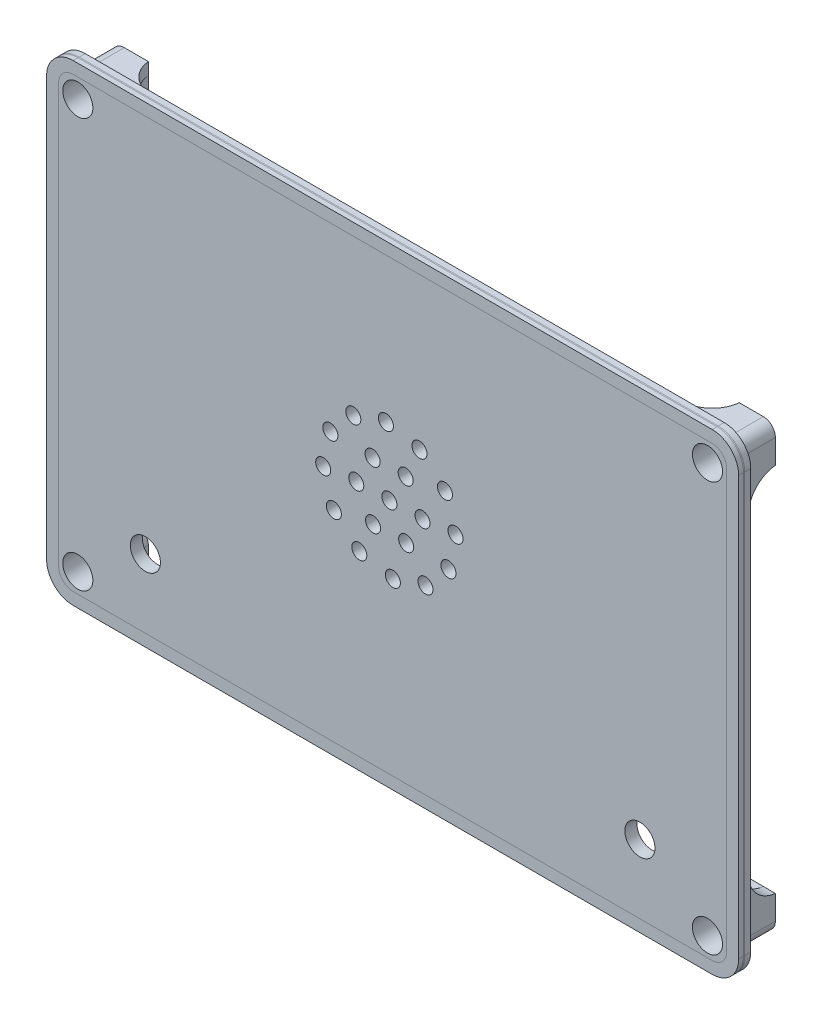
from build123d import *

# Parameters (mm, degrees)
SKETCH_4_R            = 1.5
EXTRUDE_2_DEPTH       = 2
SKETCH_5_W            = 106.12
SKETCH_5_H            = 69.56
EXTRUDE_1_DEPTH       = 2
SKETCH_6_W            = 6
SKETCH_6_H            = 6
EXTRUDE_3_DEPTH       = 6.5
FILLET_1_R            = 2
CUT_EXTRUDE_START     = -7
SKETCH_10_R           = 1.5
CUT_EXTRUDE_1_DEPTH   = 7
SKETCH_11_R           = 2.5
CUT_EXTRUDE_2_DEPTH   = 6
FILLET_2_R            = 2
SKETCH_12_R           = 2.5
CUT_EXTRUDE_3_DEPTH   = 2
SKETCH_14_R           = 17.2
SKETCH_14_R_2         = 15.2
EXTRUDE_2_2_DEPTH     = 1
FILLET_3_R            = 5
CUT_EXTRUDE_1_2_DEPTH = 1
WHITE_DEPTH           = 1
CUT_EXTRUDE_START_2   = -1
CUT_EXTRUDE_2_2_DEPTH = 1
WHITE2_DEPTH          = 1
CUT_EXTRUDE_START_3   = -0.8
CUT_EXTRUDE_4_DEPTH   = 0.8
EXTRUDE_5_DEPTH       = 0.8
SKETCH_25_R           = 1.25
CUT_EXTRUDE_5_DEPTH   = 2


with BuildPart() as part:
    # Эскиз4 → Extrude 2 (new body)
    with BuildSketch(Plane.XY):
        with BuildLine():
            Line((-57.46, 34.78), (-57.46, -34.78))
            ThreePointArc((-57.46, -34.78), (-56.171269837, -37.891269837), (-53.06, -39.18))
            Line((-53.06, -39.18), (53.06, -39.18))
            ThreePointArc((53.06, -39.18), (56.171269837, -37.891269837), (57.46, -34.78))
            Line((57.46, -34.78), (57.46, 34.78))
            ThreePointArc((57.46, 34.78), (56.171269837, 37.891269837), (53.06, 39.18))
            Line((53.06, 39.18), (-53.06, 39.18))
            ThreePointArc((-53.06, 39.18), (-56.171269837, 37.891269837), (-57.46, 34.78))
        make_face()
        with Locations((52.28, 34)):
            Circle(SKETCH_4_R, mode=Mode.SUBTRACT)
        with Locations((-52.27849471, 33.999000444)):
            Circle(SKETCH_4_R, mode=Mode.SUBTRACT)
        with Locations((-52.278761377, -33.94623289)):
            Circle(SKETCH_4_R, mode=Mode.SUBTRACT)
        with Locations((52.28, -34)):
            Circle(SKETCH_4_R, mode=Mode.SUBTRACT)
    extrude(amount=EXTRUDE_2_DEPTH)

    # Эскиз5 → Вытянуть-Тонкостенный1 (add)
    with BuildSketch(Plane(origin=(0, 0, 0), x_dir=(-1, 0, 0), z_dir=(0, 0, -1))):
        with BuildLine():
            Line((53.06, -36.78), (-53.06, -36.78))
            ThreePointArc((-53.06, -36.78), (-54.474213562, -36.194213562), (-55.06, -34.78))
            Line((-55.06, -34.78), (-55.06, 34.78))
            ThreePointArc((-55.06, 34.78), (-54.474213562, 36.194213562), (-53.06, 36.78))
            Line((-53.06, 36.78), (53.06, 36.78))
            ThreePointArc((53.06, 36.78), (54.474213562, 36.194213562), (55.06, 34.78))
            Line((55.06, 34.78), (55.06, -34.78))
            ThreePointArc((55.06, -34.78), (54.474213562, -36.194213562), (53.06, -36.78))
        make_face()
        Rectangle(SKETCH_5_W, SKETCH_5_H, mode=Mode.SUBTRACT)
    extrude(amount=EXTRUDE_1_DEPTH)

    # Эскиз6 → Бобышка-Вытянуть3 (add)
    with BuildSketch(Plane(origin=(0, 0, 0), x_dir=(-1, 0, 0), z_dir=(0, 0, -1))):
        with Locations((-52.06, 33.78)):
            Rectangle(SKETCH_6_W, SKETCH_6_H)
        with Locations((52.06, 33.78)):
            Rectangle(SKETCH_6_W, SKETCH_6_H)
        with Locations((-52.06, -33.78)):
            Rectangle(SKETCH_6_W, SKETCH_6_H)
        with Locations((52.06, -33.78)):
            Rectangle(SKETCH_6_W, SKETCH_6_H)
    extrude(amount=EXTRUDE_3_DEPTH)

    # Скругление1
    fillet_1_edges = [part.edges().sort_by_distance(p)[0] for p in [
        (-55.06, 36.78, -3.25),
        (55.06, -36.78, -3.25),
        (-55.06, -36.78, -3.25),
        (55.06, 36.78, -3.25),
    ]]
    fillet(fillet_1_edges, radius=FILLET_1_R)

    # Эскиз10 → Cut-Extrude 1 (cut)
    with BuildSketch(Plane.XY.offset(CUT_EXTRUDE_START)):
        with Locations((-52.27849471, 33.999000444)):
            Circle(SKETCH_10_R)
        with Locations(Location((52.28, 34, 0), (0, 0, 180))):
            Circle(SKETCH_10_R)
        with Locations((52.28, -34)):
            Circle(SKETCH_10_R)
        with Locations(Location((-52.278761377, -33.94623289, 0), (0, 0, 180))):
            Circle(SKETCH_10_R)
    extrude(amount=CUT_EXTRUDE_1_DEPTH, mode=Mode.SUBTRACT)

    # Эскиз11 → Cut-Extrude 2 (cut)
    with BuildSketch(Plane.XY.offset(2)):
        with Locations((-52.27849471, 33.999000444)):
            Circle(SKETCH_11_R)
        with Locations((52.28, 34)):
            Circle(SKETCH_11_R)
        with Locations((52.28, -34)):
            Circle(SKETCH_11_R)
        with Locations((-52.278761377, -33.94623289)):
            Circle(SKETCH_11_R)
    extrude(amount=-CUT_EXTRUDE_2_DEPTH, mode=Mode.SUBTRACT)

    # Скругление2
    fillet_2_edges = [part.edges().sort_by_distance(p)[0] for p in [
        (-49.06, 30.78, -3.25),
        (49.06, -30.78, -3.25),
        (-49.06, -30.78, -3.25),
        (49.06, 30.78, -3.25),
    ]]
    fillet(fillet_2_edges, radius=FILLET_2_R)

    # Эскиз12 → Вырез-Вытянуть3 (cut)
    with BuildSketch(Plane(origin=(0, 0, 0), x_dir=(-1, 0, 0), z_dir=(0, 0, -1))):
        with Locations((41.06, -25.78)):
            Circle(SKETCH_12_R)
        with Locations((-41.06, -25.78)):
            Circle(SKETCH_12_R)
    extrude(amount=-CUT_EXTRUDE_3_DEPTH, mode=Mode.SUBTRACT)

    # Эскиз14 → Extrude 2 2 (add)
    with BuildSketch(Plane(origin=(0, 0, 0), x_dir=(-1, 0, 0), z_dir=(0, 0, -1))):
        with Locations((0.54, 2.18)):
            Circle(SKETCH_14_R)
        with Locations((0.54, 2.18)):
            Circle(SKETCH_14_R_2, mode=Mode.SUBTRACT)
    extrude(amount=EXTRUDE_2_2_DEPTH)

    # Скругление3
    # the kernel refuses this fillet: 5 mm, written as the material it adds along each edge
    with BuildSketch(Plane(origin=(53.06, -30.78, -2), x_dir=(0, 0, -1), z_dir=(1, 0, 0)), Plane(origin=(-53.06, 30.78, -2), x_dir=(0, 0, -1), z_dir=(-1, 0, 0)), Plane(origin=(-49.06, 36.78, -2), x_dir=(0, 0, -1), z_dir=(0, -1, 0)), Plane(origin=(49.06, -36.78, -2), x_dir=(0, 0, -1), z_dir=(0, 1, 0))) as fillet_3_piece_1:
        with BuildLine():
            CenterArc((5, 4.974937186), FILLET_3_R, 180, 84.260829523)
            Line((0, 4.974937186), (-0.1, 4.974937186))
            Line((-0.1, 4.974937186), (-0.1, 0))
            Line((-0.1, 0), (0, -0.1))
            ThreePointArc((0, -0.1), (2.25, -0.1), (4.49, -0.099498744))
            Line((4.49, -0.099498744), (4.5, 0))
        make_face()
    extrude(amount=2)
    with BuildSketch(Plane(origin=(53.06, 30.78, -2), x_dir=(0, -1, 0), z_dir=(1, 0, 0)), Plane(origin=(-49.06, -36.78, -2), x_dir=(1, 0, 0), z_dir=(0, 1, 0))) as fillet_3_piece_2:
        with BuildLine():
            CenterArc((4.974937186, 5), FILLET_3_R, 185.739170477, 84.260829523)
            Line((0, 4.5), (-0.099498744, 4.49))
            ThreePointArc((-0.099498744, 4.49), (-0.1, 2.25), (-0.1, 0))
            Line((-0.1, 0), (0, -0.1))
            Line((0, -0.1), (4.974937186, -0.1))
            Line((4.974937186, -0.1), (4.974937186, 0))
        make_face()
    extrude(amount=2)
    with BuildSketch(Plane(origin=(49.06, 36.78, -2), x_dir=(0, 0, -1), z_dir=(0, -1, 0)), Plane(origin=(-53.06, -30.78, -2), x_dir=(0, 0, -1), z_dir=(-1, 0, 0))) as fillet_3_piece_3:
        with BuildLine():
            CenterArc((5, -4.974937186), FILLET_3_R, 95.739170477, 84.260829523)
            Line((0, -4.974937186), (-0.1, -4.974937186))
            Line((-0.1, -4.974937186), (-0.1, 0))
            Line((-0.1, 0), (0, 0.1))
            ThreePointArc((0, 0.1), (2.25, 0.1), (4.49, 0.099498744))
            Line((4.49, 0.099498744), (4.5, 0))
        make_face()
    extrude(amount=2)

    # Эскиз16 → Cut-Extrude 1 2 (cut)
    with BuildSketch(Plane(origin=(0, 0, 0), x_dir=(-1, 0, 0), z_dir=(0, 0, -1))):
        with BuildLine():
            Line((57.46, -34.78), (57.46, 34.78))
            ThreePointArc((57.46, 34.78), (56.171269837, 37.891269837), (53.06, 39.18))
            Line((53.06, 39.18), (-53.06, 39.18))
            ThreePointArc((-53.06, 39.18), (-56.171269837, 37.891269837), (-57.46, 34.78))
            Line((-57.46, 34.78), (-57.46, -34.78))
            ThreePointArc((-57.46, -34.78), (-56.171269837, -37.891269837), (-53.06, -39.18))
            Line((-53.06, -39.18), (53.06, -39.18))
            ThreePointArc((53.06, -39.18), (56.171269837, -37.891269837), (57.46, -34.78))
        make_face()
        with BuildLine():
            Line((55.46, -34.78), (55.46, 34.78))
            ThreePointArc((55.46, 34.78), (54.757056275, 36.477056275), (53.06, 37.18))
            Line((53.06, 37.18), (-53.06, 37.18))
            ThreePointArc((-53.06, 37.18), (-54.757056275, 36.477056275), (-55.46, 34.78))
            Line((-55.46, 34.78), (-55.46, -34.78))
            ThreePointArc((-55.46, -34.78), (-54.757056275, -36.477056275), (-53.06, -37.18))
            Line((-53.06, -37.18), (53.06, -37.18))
            ThreePointArc((53.06, -37.18), (54.757056275, -36.477056275), (55.46, -34.78))
        make_face(mode=Mode.SUBTRACT)
    extrude(amount=-CUT_EXTRUDE_1_2_DEPTH, mode=Mode.SUBTRACT)

    # Эскиз18 → Cut-Extrude 2 2 (cut)
    with BuildSketch(Plane.XY.offset(2).offset(CUT_EXTRUDE_START_2)):
        with BuildLine():
            Line((53.06, 39.18), (-53.06, 39.18))
            ThreePointArc((-53.06, 39.18), (-56.171269837, 37.891269837), (-57.46, 34.78))
            Line((-57.46, 34.78), (-57.46, -34.78))
            ThreePointArc((-57.46, -34.78), (-56.171269837, -37.891269837), (-53.06, -39.18))
            Line((-53.06, -39.18), (53.06, -39.18))
            ThreePointArc((53.06, -39.18), (56.171269837, -37.891269837), (57.46, -34.78))
            Line((57.46, -34.78), (57.46, 34.78))
            ThreePointArc((57.46, 34.78), (56.171269837, 37.891269837), (53.06, 39.18))
        make_face()
        with BuildLine():
            Line((53.06, 37.68), (-53.06, 37.68))
            ThreePointArc((-53.06, 37.68), (-55.110609665, 36.830609665), (-55.96, 34.78))
            Line((-55.96, 34.78), (-55.96, -34.78))
            ThreePointArc((-55.96, -34.78), (-55.110609665, -36.830609665), (-53.06, -37.68))
            Line((-53.06, -37.68), (53.06, -37.68))
            ThreePointArc((53.06, -37.68), (55.110609665, -36.830609665), (55.96, -34.78))
            Line((55.96, -34.78), (55.96, 34.78))
            ThreePointArc((55.96, 34.78), (55.110609665, 36.830609665), (53.06, 37.68))
        make_face(mode=Mode.SUBTRACT)
    extrude(amount=CUT_EXTRUDE_2_2_DEPTH, mode=Mode.SUBTRACT)


with BuildPart() as body_2:
    # Эскиз17 → white (new body)
    with BuildSketch(Plane(origin=(0, 0, 1), x_dir=(-1, 0, 0), z_dir=(0, 0, -1))):
        with BuildLine():
            Line((57.46, -34.78), (57.46, 34.78))
            ThreePointArc((57.46, 34.78), (56.171269837, 37.891269837), (53.06, 39.18))
            Line((53.06, 39.18), (-53.06, 39.18))
            ThreePointArc((-53.06, 39.18), (-56.171269837, 37.891269837), (-57.46, 34.78))
            Line((-57.46, 34.78), (-57.46, -34.78))
            ThreePointArc((-57.46, -34.78), (-56.171269837, -37.891269837), (-53.06, -39.18))
            Line((-53.06, -39.18), (53.06, -39.18))
            ThreePointArc((53.06, -39.18), (56.171269837, -37.891269837), (57.46, -34.78))
        make_face()
        with BuildLine():
            Line((55.46, -34.78), (55.46, 34.78))
            ThreePointArc((55.46, 34.78), (54.757056275, 36.477056275), (53.06, 37.18))
            Line((53.06, 37.18), (-53.06, 37.18))
            ThreePointArc((-53.06, 37.18), (-54.757056275, 36.477056275), (-55.46, 34.78))
            Line((-55.46, 34.78), (-55.46, -34.78))
            ThreePointArc((-55.46, -34.78), (-54.757056275, -36.477056275), (-53.06, -37.18))
            Line((-53.06, -37.18), (53.06, -37.18))
            ThreePointArc((53.06, -37.18), (54.757056275, -36.477056275), (55.46, -34.78))
        make_face(mode=Mode.SUBTRACT)
    extrude(amount=WHITE_DEPTH)


with BuildPart() as body_3:
    # Эскиз19 → white2 (new body)
    with BuildSketch(Plane.XY.offset(1)):
        with BuildLine():
            Line((53.06, 39.18), (-53.06, 39.18))
            ThreePointArc((-53.06, 39.18), (-56.171269837, 37.891269837), (-57.46, 34.78))
            Line((-57.46, 34.78), (-57.46, -34.78))
            ThreePointArc((-57.46, -34.78), (-56.171269837, -37.891269837), (-53.06, -39.18))
            Line((-53.06, -39.18), (53.06, -39.18))
            ThreePointArc((53.06, -39.18), (56.171269837, -37.891269837), (57.46, -34.78))
            Line((57.46, -34.78), (57.46, 34.78))
            ThreePointArc((57.46, 34.78), (56.171269837, 37.891269837), (53.06, 39.18))
        make_face()
        with BuildLine():
            Line((53.06, 37.68), (-53.06, 37.68))
            ThreePointArc((-53.06, 37.68), (-55.110609665, 36.830609665), (-55.96, 34.78))
            Line((-55.96, 34.78), (-55.96, -34.78))
            ThreePointArc((-55.96, -34.78), (-55.110609665, -36.830609665), (-53.06, -37.68))
            Line((-53.06, -37.68), (53.06, -37.68))
            ThreePointArc((53.06, -37.68), (55.110609665, -36.830609665), (55.96, -34.78))
            Line((55.96, -34.78), (55.96, 34.78))
            ThreePointArc((55.96, 34.78), (55.110609665, 36.830609665), (53.06, 37.68))
        make_face(mode=Mode.SUBTRACT)
    extrude(amount=WHITE2_DEPTH)


with BuildPart() as cut_extrude_4_tool:
    # Эскиз21 → Вырез-Вытянуть-Тонкостенный4 (new body)
    with BuildSketch(Plane.XY.offset(2).offset(CUT_EXTRUDE_START_3)):
        with BuildLine():
            Line((53.06, 39.18), (-53.06, 39.18))
            ThreePointArc((-53.06, 39.18), (-56.171269837, 37.891269837), (-57.46, 34.78))
            Line((-57.46, 34.78), (-57.46, -34.78))
            ThreePointArc((-57.46, -34.78), (-56.171269837, -37.891269837), (-53.06, -39.18))
            Line((-53.06, -39.18), (53.06, -39.18))
            ThreePointArc((53.06, -39.18), (56.171269837, -37.891269837), (57.46, -34.78))
            Line((57.46, -34.78), (57.46, 34.78))
            ThreePointArc((57.46, 34.78), (56.171269837, 37.891269837), (53.06, 39.18))
        make_face()
        with BuildLine():
            Line((53.06, 37.18), (-53.06, 37.18))
            ThreePointArc((-53.06, 37.18), (-54.757056275, 36.477056275), (-55.46, 34.78))
            Line((-55.46, 34.78), (-55.46, -34.78))
            ThreePointArc((-55.46, -34.78), (-54.757056275, -36.477056275), (-53.06, -37.18))
            Line((-53.06, -37.18), (53.06, -37.18))
            ThreePointArc((53.06, -37.18), (54.757056275, -36.477056275), (55.46, -34.78))
            Line((55.46, -34.78), (55.46, 34.78))
            ThreePointArc((55.46, 34.78), (54.757056275, 36.477056275), (53.06, 37.18))
        make_face(mode=Mode.SUBTRACT)
    extrude(amount=CUT_EXTRUDE_4_DEPTH)


with BuildPart() as part_1:
    add(part.part)

    # Вырез-Вытянуть-Тонкостенный4: cut by cut_extrude_4_tool
    add(cut_extrude_4_tool.part, mode=Mode.SUBTRACT)

    # Эскиз25 → Вырез-Вытянуть5 (cut)
    with BuildSketch(Plane(origin=(0, 0, 0), x_dir=(-1, 0, 0), z_dir=(0, 0, -1))):
        with Locations((-4.454785419, 11.980618278)):
            Circle(SKETCH_25_R)
        with Locations((1.11469808, 13.16497711)):
            Circle(SKETCH_25_R)
        with Locations((6.530191692, 11.405920198)):
            Circle(SKETCH_25_R)
        with Locations((10.340618278, 7.174785419)):
            Circle(SKETCH_25_R)
        with Locations((11.52497711, 1.60530192)):
            Circle(SKETCH_25_R)
        with Locations((9.765920198, -3.810191692)):
            Circle(SKETCH_25_R)
        with Locations((5.534785419, -7.620618278)):
            Circle(SKETCH_25_R)
        with Locations((-0.03469808, -8.80497711)):
            Circle(SKETCH_25_R)
        with Locations((-5.450191692, -7.045920198)):
            Circle(SKETCH_25_R)
        with Locations((-9.260618278, -2.814785419)):
            Circle(SKETCH_25_R)
        with Locations((-10.44497711, 2.75469808)):
            Circle(SKETCH_25_R)
        with Locations((-8.685920198, 8.170191692)):
            Circle(SKETCH_25_R)
        with Locations((-2.173377314, 6.964096942)):
            Circle(SKETCH_25_R)
        with Locations((3.326460829, 6.921902155)):
            Circle(SKETCH_25_R)
        with Locations((6.039838143, 2.137805213)):
            Circle(SKETCH_25_R)
        with Locations((3.253377314, -2.604096942)):
            Circle(SKETCH_25_R)
        with Locations((-2.246460829, -2.561902155)):
            Circle(SKETCH_25_R)
        with Locations((-4.959838143, 2.222194787)):
            Circle(SKETCH_25_R)
        with Locations((0.54, 2.18)):
            Circle(SKETCH_25_R)
    extrude(amount=-CUT_EXTRUDE_5_DEPTH, mode=Mode.SUBTRACT)


with BuildPart() as body_3_1:
    add(body_3.part)

    # Вырез-Вытянуть-Тонкостенный4: cut by cut_extrude_4_tool
    add(cut_extrude_4_tool.part, mode=Mode.SUBTRACT)


with BuildPart() as body_4:
    # Эскиз22 → Вытянуть-Тонкостенный5 (new body)
    with BuildSketch(Plane.XY.offset(1.2)):
        with BuildLine():
            Line((53.06, 39.18), (-53.06, 39.18))
            ThreePointArc((-53.06, 39.18), (-56.171269837, 37.891269837), (-57.46, 34.78))
            Line((-57.46, 34.78), (-57.46, -34.78))
            ThreePointArc((-57.46, -34.78), (-56.171269837, -37.891269837), (-53.06, -39.18))
            Line((-53.06, -39.18), (53.06, -39.18))
            ThreePointArc((53.06, -39.18), (56.171269837, -37.891269837), (57.46, -34.78))
            Line((57.46, -34.78), (57.46, 34.78))
            ThreePointArc((57.46, 34.78), (56.171269837, 37.891269837), (53.06, 39.18))
        make_face()
        with BuildLine():
            Line((53.06, 37.18), (-53.06, 37.18))
            ThreePointArc((-53.06, 37.18), (-54.757056275, 36.477056275), (-55.46, 34.78))
            Line((-55.46, 34.78), (-55.46, -34.78))
            ThreePointArc((-55.46, -34.78), (-54.757056275, -36.477056275), (-53.06, -37.18))
            Line((-53.06, -37.18), (53.06, -37.18))
            ThreePointArc((53.06, -37.18), (54.757056275, -36.477056275), (55.46, -34.78))
            Line((55.46, -34.78), (55.46, 34.78))
            ThreePointArc((55.46, 34.78), (54.757056275, 36.477056275), (53.06, 37.18))
        make_face(mode=Mode.SUBTRACT)
    extrude(amount=EXTRUDE_5_DEPTH)


solid = Compound([body_2.part, part_1.part, body_3_1.part, body_4.part])
